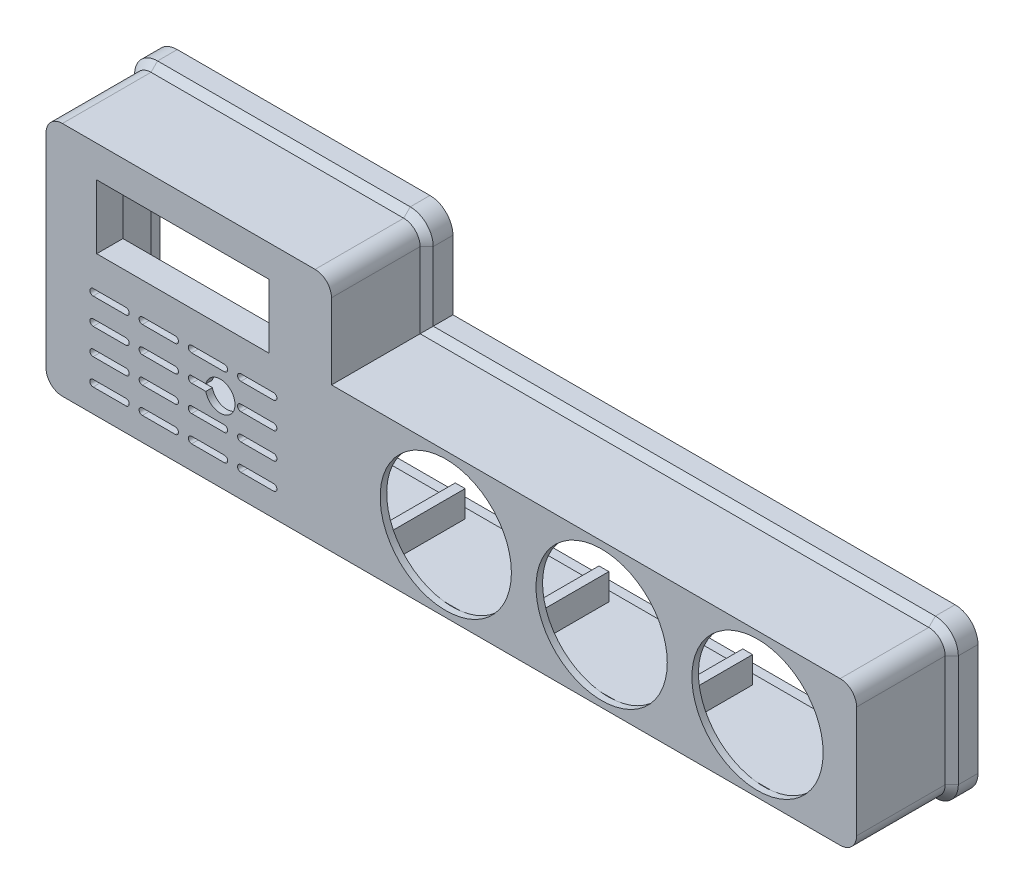
from build123d import *

# Parameters (mm, degrees)
EXTRUDE_1_DEPTH      = 30
EXTRUDE_START        = -2
EXTRUDE_2_DEPTH      = 2
SKETCH_3_R           = 20
CUT_EXTRUDE_1_DEPTH  = 2
EXTRUDE_3_DEPTH      = 5
EXTRUDE_3_DEPTH_BACK = 1
CHAMFER_1_SIZE       = 2
SKETCH_5_W           = 52.5
SKETCH_5_H           = 19.5
CUT_EXTRUDE_2_DEPTH  = 5
SKETCH_7_W           = 64.5
SKETCH_7_H           = 25.5
SKETCH_7_W_2         = 52.5
SKETCH_7_H_2         = 19.5
EXTRUDE_4_DEPTH      = 6
SKETCH_8_R           = 1.5
CUT_EXTRUDE_3_DEPTH  = 7
CUT_EXTRUDE_4_REACH  = 259.47
CUT_EXTRUDE_5_REACH  = 258.838
SKETCH_12_W          = 3
SKETCH_12_H          = 8
EXTRUDE_5_DEPTH      = 25
CUT_EXTRUDE_6_REACH  = 259.47
SKETCH_13_R          = 4.5


with BuildPart() as part:
    # 草图1 → 凸台-拉伸1 (new body)
    with BuildSketch(Plane.XY):
        with BuildLine():
            Line((78, 3), (1, 3))
            ThreePointArc((1, 3), (-2.535533906, 1.535533906), (-4, -2))
            Line((-4, -2), (-4, -64))
            ThreePointArc((-4, -64), (-2.535533906, -67.535533906), (1, -69))
            Line((1, -69), (238, -69))
            ThreePointArc((238, -69), (241.535533906, -67.535533906), (243, -64))
            Line((243, -64), (243, -30))
            ThreePointArc((243, -30), (241.535533906, -26.464466094), (238, -25))
            Line((238, -25), (83, -25))
            Line((83, -25), (83, -2))
            ThreePointArc((83, -2), (81.535533906, 1.535533906), (78, 3))
        make_face()
        with BuildLine():
            Line((238, -27), (81, -27))
            Line((81, -27), (81, -2))
            ThreePointArc((81, -2), (80.121320344, 0.121320344), (78, 1))
            Line((78, 1), (1, 1))
            ThreePointArc((1, 1), (-1.121320344, 0.121320344), (-2, -2))
            Line((-2, -2), (-2, -64))
            ThreePointArc((-2, -64), (-1.121320344, -66.121320344), (1, -67))
            Line((1, -67), (238, -67))
            ThreePointArc((238, -67), (240.121320344, -66.121320344), (241, -64))
            Line((241, -64), (241, -30))
            ThreePointArc((241, -30), (240.121320344, -27.878679656), (238, -27))
        make_face(mode=Mode.SUBTRACT)
    extrude(amount=EXTRUDE_1_DEPTH)

    # 草图2 → 凸台-拉伸2 (add)
    with BuildSketch(Plane.XY.offset(30).offset(EXTRUDE_START)):
        with BuildLine():
            Line((78, 3), (1, 3))
            ThreePointArc((1, 3), (-2.535533906, 1.535533906), (-4, -2))
            Line((-4, -2), (-4, -64))
            ThreePointArc((-4, -64), (-2.535533906, -67.535533906), (1, -69))
            Line((1, -69), (238, -69))
            ThreePointArc((238, -69), (241.535533906, -67.535533906), (243, -64))
            Line((243, -64), (243, -30))
            ThreePointArc((243, -30), (241.535533906, -26.464466094), (238, -25))
            Line((238, -25), (83, -25))
            Line((83, -25), (83, -2))
            ThreePointArc((83, -2), (81.535533906, 1.535533906), (78, 3))
        make_face()
    extrude(amount=EXTRUDE_2_DEPTH)

    # 草图3 → 切除-拉伸1 (cut)
    with BuildSketch(Plane.XY.offset(30)):
        with Locations((117.815248816, -47.15)):
            Circle(SKETCH_3_R)
        with Locations((165.315248816, -47.15)):
            Circle(SKETCH_3_R)
        with Locations((212.815248816, -47.15)):
            Circle(SKETCH_3_R)
    extrude(amount=-CUT_EXTRUDE_1_DEPTH, mode=Mode.SUBTRACT)


with BuildPart() as body_2:
    # 草图4 → 凸台-拉伸3 (new, two sides: drawn at the far end of the back side and taken through both)
    with BuildSketch(Plane(origin=(0, 0, 0), x_dir=(-1, 0, 0), z_dir=(0, 0, -1)).offset(-EXTRUDE_3_DEPTH_BACK)):
        with BuildLine():
            Line((-238, -71), (-1, -71))
            ThreePointArc((-1, -71), (3.949747468, -68.949747468), (6, -64))
            Line((6, -64), (6, -2))
            ThreePointArc((6, -2), (3.949747468, 2.949747468), (-1, 5))
            Line((-1, 5), (-78, 5))
            ThreePointArc((-78, 5), (-82.949747468, 2.949747468), (-85, -2))
            Line((-85, -2), (-85, -23))
            Line((-85, -23), (-238, -23))
            ThreePointArc((-238, -23), (-242.949747468, -25.050252532), (-245, -30))
            Line((-245, -30), (-245, -64))
            ThreePointArc((-245, -64), (-242.949747468, -68.949747468), (-238, -71))
        make_face()
        with BuildLine():
            Line((-83, -2), (-83, -25))
            Line((-83, -25), (-238, -25))
            ThreePointArc((-238, -25), (-241.535533906, -26.464466094), (-243, -30))
            Line((-243, -30), (-243, -64))
            ThreePointArc((-243, -64), (-241.535533906, -67.535533906), (-238, -69))
            Line((-238, -69), (-1, -69))
            ThreePointArc((-1, -69), (2.535533906, -67.535533906), (4, -64))
            Line((4, -64), (4, -2))
            ThreePointArc((4, -2), (2.535533906, 1.535533906), (-1, 3))
            Line((-1, 3), (-78, 3))
            ThreePointArc((-78, 3), (-81.535533906, 1.535533906), (-83, -2))
        make_face(mode=Mode.SUBTRACT)
    extrude(amount=EXTRUDE_3_DEPTH + EXTRUDE_3_DEPTH_BACK)


with BuildPart() as part_1:
    add(part.part)

    # Combine 2: union body 2
    add(body_2.part)

    # 倒角1
    chamfer_1_edges = [part_1.edges().sort_by_distance(p)[0] for p in [
        (39.5, 3, 1),
        (81.535533906, 1.535533906, 1),
        (83, -13.5, 1),
        (160.5, -25, 1),
        (241.535533906, -26.464466094, 1),
        (243, -47, 1),
        (241.535533906, -67.535533906, 1),
        (119.5, -69, 1),
        (-2.535533906, -67.535533906, 1),
        (-4, -33, 1),
        (-2.535533906, 1.535533906, 1),
    ]]
    chamfer(chamfer_1_edges, length=CHAMFER_1_SIZE - 0.0001)  # a hair under: the kernel refuses the full size

    # 草图5 → 切除-拉伸2 (cut)
    with BuildSketch(Plane.XY.offset(30)):
        with Locations((37.697321385, -16.407805751)):
            Rectangle(SKETCH_5_W, SKETCH_5_H)
    extrude(amount=-CUT_EXTRUDE_2_DEPTH, mode=Mode.SUBTRACT)

    # 草图7 → 凸台-拉伸4 (add)
    with BuildSketch(Plane(origin=(0, 0, 28), x_dir=(-1, 0, 0), z_dir=(0, 0, -1))):
        with Locations((-37.697321385, -16.407805751)):
            Rectangle(SKETCH_7_W, SKETCH_7_H)
        with Locations((-37.697321385, -16.407805751)):
            Rectangle(SKETCH_7_W_2, SKETCH_7_H_2, mode=Mode.SUBTRACT)
    extrude(amount=EXTRUDE_4_DEPTH)

    # 草图8 → 切除-拉伸3 (cut)
    with BuildSketch(Plane(origin=(0, 0, 22), x_dir=(-1, 0, 0), z_dir=(0, 0, -1))):
        with Locations((-8.697321385, -6.207805751)):
            Circle(SKETCH_8_R)
        with Locations((-8.697321385, -26.607805751)):
            Circle(SKETCH_8_R)
        with Locations((-66.697321385, -26.607805751)):
            Circle(SKETCH_8_R)
        with Locations((-66.697321385, -6.207805751)):
            Circle(SKETCH_8_R)
    extrude(amount=-CUT_EXTRUDE_3_DEPTH, mode=Mode.SUBTRACT)

    # 草图9 → 切除-拉伸4 (cut, up to next)
    with BuildSketch(Plane.XY.offset(30), mode=Mode.PRIVATE) as cut_extrude_4_sk1:
        with BuildLine():
            Line((10.367590172, -35.855469826), (20.367590172, -35.855469826))
            ThreePointArc((20.367590172, -35.855469826), (21.367590172, -36.855469826), (20.367590172, -37.855469826))
            Line((20.367590172, -37.855469826), (10.367590172, -37.855469826))
            ThreePointArc((10.367590172, -37.855469826), (9.367590172, -36.855469826), (10.367590172, -35.855469826))
        make_face()
    cut_extrude_4_tool1 = extrude(cut_extrude_4_sk1.sketch, amount=-CUT_EXTRUDE_4_REACH, mode=Mode.PRIVATE) & part_1.part
    # 草图9 → 切除-拉伸4 (cut, up to next)
    with BuildSketch(Plane.XY.offset(30), mode=Mode.PRIVATE) as cut_extrude_4_sk2:
        with BuildLine():
            Line((25.367590172, -35.855469826), (35.367590172, -35.855469826))
            ThreePointArc((35.367590172, -35.855469826), (36.367590172, -36.855469826), (35.367590172, -37.855469826))
            Line((35.367590172, -37.855469826), (25.367590172, -37.855469826))
            ThreePointArc((25.367590172, -37.855469826), (24.367590172, -36.855469826), (25.367590172, -35.855469826))
        make_face()
    cut_extrude_4_tool2 = extrude(cut_extrude_4_sk2.sketch, amount=-CUT_EXTRUDE_4_REACH, mode=Mode.PRIVATE) & part_1.part
    # 草图9 → 切除-拉伸4 (cut, up to next)
    with BuildSketch(Plane.XY.offset(30), mode=Mode.PRIVATE) as cut_extrude_4_sk3:
        with BuildLine():
            Line((40.367590172, -35.855469826), (50.367590172, -35.855469826))
            ThreePointArc((50.367590172, -35.855469826), (51.367590172, -36.855469826), (50.367590172, -37.855469826))
            Line((50.367590172, -37.855469826), (40.367590172, -37.855469826))
            ThreePointArc((40.367590172, -37.855469826), (39.367590172, -36.855469826), (40.367590172, -35.855469826))
        make_face()
    cut_extrude_4_tool3 = extrude(cut_extrude_4_sk3.sketch, amount=-CUT_EXTRUDE_4_REACH, mode=Mode.PRIVATE) & part_1.part
    # 草图9 → 切除-拉伸4 (cut, up to next)
    with BuildSketch(Plane.XY.offset(30), mode=Mode.PRIVATE) as cut_extrude_4_sk4:
        with BuildLine():
            Line((55.367590172, -35.855469826), (65.367590172, -35.855469826))
            ThreePointArc((65.367590172, -35.855469826), (66.367590172, -36.855469826), (65.367590172, -37.855469826))
            Line((65.367590172, -37.855469826), (55.367590172, -37.855469826))
            ThreePointArc((55.367590172, -37.855469826), (54.367590172, -36.855469826), (55.367590172, -35.855469826))
        make_face()
    cut_extrude_4_tool4 = extrude(cut_extrude_4_sk4.sketch, amount=-CUT_EXTRUDE_4_REACH, mode=Mode.PRIVATE) & part_1.part
    # 草图9 → 切除-拉伸4 (cut, up to next)
    with BuildSketch(Plane.XY.offset(30), mode=Mode.PRIVATE) as cut_extrude_4_sk5:
        with BuildLine():
            Line((25.367590172, -43.855469826), (35.367590172, -43.855469826))
            ThreePointArc((35.367590172, -43.855469826), (36.367590172, -44.855469826), (35.367590172, -45.855469826))
            Line((35.367590172, -45.855469826), (25.367590172, -45.855469826))
            ThreePointArc((25.367590172, -45.855469826), (24.367590172, -44.855469826), (25.367590172, -43.855469826))
        make_face()
    cut_extrude_4_tool5 = extrude(cut_extrude_4_sk5.sketch, amount=-CUT_EXTRUDE_4_REACH, mode=Mode.PRIVATE) & part_1.part
    # 草图9 → 切除-拉伸4 (cut, up to next)
    with BuildSketch(Plane.XY.offset(30), mode=Mode.PRIVATE) as cut_extrude_4_sk6:
        with BuildLine():
            Line((40.367590172, -43.855469826), (50.367590172, -43.855469826))
            ThreePointArc((50.367590172, -43.855469826), (51.367590172, -44.855469826), (50.367590172, -45.855469826))
            Line((50.367590172, -45.855469826), (40.367590172, -45.855469826))
            ThreePointArc((40.367590172, -45.855469826), (39.367590172, -44.855469826), (40.367590172, -43.855469826))
        make_face()
    cut_extrude_4_tool6 = extrude(cut_extrude_4_sk6.sketch, amount=-CUT_EXTRUDE_4_REACH, mode=Mode.PRIVATE) & part_1.part
    # 草图9 → 切除-拉伸4 (cut, up to next)
    with BuildSketch(Plane.XY.offset(30), mode=Mode.PRIVATE) as cut_extrude_4_sk7:
        with BuildLine():
            Line((55.367590172, -43.855469826), (65.367590172, -43.855469826))
            ThreePointArc((65.367590172, -43.855469826), (66.367590172, -44.855469826), (65.367590172, -45.855469826))
            Line((65.367590172, -45.855469826), (55.367590172, -45.855469826))
            ThreePointArc((55.367590172, -45.855469826), (54.367590172, -44.855469826), (55.367590172, -43.855469826))
        make_face()
    cut_extrude_4_tool7 = extrude(cut_extrude_4_sk7.sketch, amount=-CUT_EXTRUDE_4_REACH, mode=Mode.PRIVATE) & part_1.part
    # 草图9 → 切除-拉伸4 (cut, up to next)
    with BuildSketch(Plane.XY.offset(30), mode=Mode.PRIVATE) as cut_extrude_4_sk8:
        with BuildLine():
            Line((25.367590172, -51.855469826), (35.367590172, -51.855469826))
            ThreePointArc((35.367590172, -51.855469826), (36.367590172, -52.855469826), (35.367590172, -53.855469826))
            Line((35.367590172, -53.855469826), (25.367590172, -53.855469826))
            ThreePointArc((25.367590172, -53.855469826), (24.367590172, -52.855469826), (25.367590172, -51.855469826))
        make_face()
    cut_extrude_4_tool8 = extrude(cut_extrude_4_sk8.sketch, amount=-CUT_EXTRUDE_4_REACH, mode=Mode.PRIVATE) & part_1.part
    # 草图9 → 切除-拉伸4 (cut, up to next)
    with BuildSketch(Plane.XY.offset(30), mode=Mode.PRIVATE) as cut_extrude_4_sk9:
        with BuildLine():
            Line((40.367590172, -51.855469826), (50.367590172, -51.855469826))
            ThreePointArc((50.367590172, -51.855469826), (51.367590172, -52.855469826), (50.367590172, -53.855469826))
            Line((50.367590172, -53.855469826), (40.367590172, -53.855469826))
            ThreePointArc((40.367590172, -53.855469826), (39.367590172, -52.855469826), (40.367590172, -51.855469826))
        make_face()
    cut_extrude_4_tool9 = extrude(cut_extrude_4_sk9.sketch, amount=-CUT_EXTRUDE_4_REACH, mode=Mode.PRIVATE) & part_1.part
    # 草图9 → 切除-拉伸4 (cut, up to next)
    with BuildSketch(Plane.XY.offset(30), mode=Mode.PRIVATE) as cut_extrude_4_sk10:
        with BuildLine():
            Line((55.367590172, -51.855469826), (65.367590172, -51.855469826))
            ThreePointArc((65.367590172, -51.855469826), (66.367590172, -52.855469826), (65.367590172, -53.855469826))
            Line((65.367590172, -53.855469826), (55.367590172, -53.855469826))
            ThreePointArc((55.367590172, -53.855469826), (54.367590172, -52.855469826), (55.367590172, -51.855469826))
        make_face()
    cut_extrude_4_tool10 = extrude(cut_extrude_4_sk10.sketch, amount=-CUT_EXTRUDE_4_REACH, mode=Mode.PRIVATE) & part_1.part
    # 草图9 → 切除-拉伸4 (cut, up to next)
    with BuildSketch(Plane.XY.offset(30), mode=Mode.PRIVATE) as cut_extrude_4_sk11:
        with BuildLine():
            Line((25.367590172, -59.855469826), (35.367590172, -59.855469826))
            ThreePointArc((35.367590172, -59.855469826), (36.367590172, -60.855469826), (35.367590172, -61.855469826))
            Line((35.367590172, -61.855469826), (25.367590172, -61.855469826))
            ThreePointArc((25.367590172, -61.855469826), (24.367590172, -60.855469826), (25.367590172, -59.855469826))
        make_face()
    cut_extrude_4_tool11 = extrude(cut_extrude_4_sk11.sketch, amount=-CUT_EXTRUDE_4_REACH, mode=Mode.PRIVATE) & part_1.part
    # 草图9 → 切除-拉伸4 (cut, up to next)
    with BuildSketch(Plane.XY.offset(30), mode=Mode.PRIVATE) as cut_extrude_4_sk12:
        with BuildLine():
            Line((40.367590172, -59.855469826), (50.367590172, -59.855469826))
            ThreePointArc((50.367590172, -59.855469826), (51.367590172, -60.855469826), (50.367590172, -61.855469826))
            Line((50.367590172, -61.855469826), (40.367590172, -61.855469826))
            ThreePointArc((40.367590172, -61.855469826), (39.367590172, -60.855469826), (40.367590172, -59.855469826))
        make_face()
    cut_extrude_4_tool12 = extrude(cut_extrude_4_sk12.sketch, amount=-CUT_EXTRUDE_4_REACH, mode=Mode.PRIVATE) & part_1.part
    # 草图9 → 切除-拉伸4 (cut, up to next)
    with BuildSketch(Plane.XY.offset(30), mode=Mode.PRIVATE) as cut_extrude_4_sk13:
        with BuildLine():
            Line((55.367590172, -59.855469826), (65.367590172, -59.855469826))
            ThreePointArc((65.367590172, -59.855469826), (66.367590172, -60.855469826), (65.367590172, -61.855469826))
            Line((65.367590172, -61.855469826), (55.367590172, -61.855469826))
            ThreePointArc((55.367590172, -61.855469826), (54.367590172, -60.855469826), (55.367590172, -59.855469826))
        make_face()
    cut_extrude_4_tool13 = extrude(cut_extrude_4_sk13.sketch, amount=-CUT_EXTRUDE_4_REACH, mode=Mode.PRIVATE) & part_1.part
    # 草图9 → 切除-拉伸4 (cut, up to next)
    with BuildSketch(Plane.XY.offset(30), mode=Mode.PRIVATE) as cut_extrude_4_sk14:
        with BuildLine():
            Line((10.367590172, -43.855469826), (20.367590172, -43.855469826))
            ThreePointArc((20.367590172, -43.855469826), (21.367590172, -44.855469826), (20.367590172, -45.855469826))
            Line((20.367590172, -45.855469826), (10.367590172, -45.855469826))
            ThreePointArc((10.367590172, -45.855469826), (9.367590172, -44.855469826), (10.367590172, -43.855469826))
        make_face()
    cut_extrude_4_tool14 = extrude(cut_extrude_4_sk14.sketch, amount=-CUT_EXTRUDE_4_REACH, mode=Mode.PRIVATE) & part_1.part
    # 草图9 → 切除-拉伸4 (cut, up to next)
    with BuildSketch(Plane.XY.offset(30), mode=Mode.PRIVATE) as cut_extrude_4_sk15:
        with BuildLine():
            Line((10.367590172, -51.855469826), (20.367590172, -51.855469826))
            ThreePointArc((20.367590172, -51.855469826), (21.367590172, -52.855469826), (20.367590172, -53.855469826))
            Line((20.367590172, -53.855469826), (10.367590172, -53.855469826))
            ThreePointArc((10.367590172, -53.855469826), (9.367590172, -52.855469826), (10.367590172, -51.855469826))
        make_face()
    cut_extrude_4_tool15 = extrude(cut_extrude_4_sk15.sketch, amount=-CUT_EXTRUDE_4_REACH, mode=Mode.PRIVATE) & part_1.part
    # 草图9 → 切除-拉伸4 (cut, up to next)
    with BuildSketch(Plane.XY.offset(30), mode=Mode.PRIVATE) as cut_extrude_4_sk16:
        with BuildLine():
            Line((10.367590172, -59.855469826), (20.367590172, -59.855469826))
            ThreePointArc((20.367590172, -59.855469826), (21.367590172, -60.855469826), (20.367590172, -61.855469826))
            Line((20.367590172, -61.855469826), (10.367590172, -61.855469826))
            ThreePointArc((10.367590172, -61.855469826), (9.367590172, -60.855469826), (10.367590172, -59.855469826))
        make_face()
    cut_extrude_4_tool16 = extrude(cut_extrude_4_sk16.sketch, amount=-CUT_EXTRUDE_4_REACH, mode=Mode.PRIVATE) & part_1.part
    add(cut_extrude_4_tool1.solids().sort_by_distance((15.36759, -36.85547, 30))[0], mode=Mode.SUBTRACT)
    add(cut_extrude_4_tool2.solids().sort_by_distance((30.36759, -36.85547, 30))[0], mode=Mode.SUBTRACT)
    add(cut_extrude_4_tool3.solids().sort_by_distance((45.36759, -36.85547, 30))[0], mode=Mode.SUBTRACT)
    add(cut_extrude_4_tool4.solids().sort_by_distance((60.36759, -36.85547, 30))[0], mode=Mode.SUBTRACT)
    add(cut_extrude_4_tool5.solids().sort_by_distance((30.36759, -44.85547, 30))[0], mode=Mode.SUBTRACT)
    add(cut_extrude_4_tool6.solids().sort_by_distance((45.36759, -44.85547, 30))[0], mode=Mode.SUBTRACT)
    add(cut_extrude_4_tool7.solids().sort_by_distance((60.36759, -44.85547, 30))[0], mode=Mode.SUBTRACT)
    add(cut_extrude_4_tool8.solids().sort_by_distance((30.36759, -52.85547, 30))[0], mode=Mode.SUBTRACT)
    add(cut_extrude_4_tool9.solids().sort_by_distance((45.36759, -52.85547, 30))[0], mode=Mode.SUBTRACT)
    add(cut_extrude_4_tool10.solids().sort_by_distance((60.36759, -52.85547, 30))[0], mode=Mode.SUBTRACT)
    add(cut_extrude_4_tool11.solids().sort_by_distance((30.36759, -60.85547, 30))[0], mode=Mode.SUBTRACT)
    add(cut_extrude_4_tool12.solids().sort_by_distance((45.36759, -60.85547, 30))[0], mode=Mode.SUBTRACT)
    add(cut_extrude_4_tool13.solids().sort_by_distance((60.36759, -60.85547, 30))[0], mode=Mode.SUBTRACT)
    add(cut_extrude_4_tool14.solids().sort_by_distance((15.36759, -44.85547, 30))[0], mode=Mode.SUBTRACT)
    add(cut_extrude_4_tool15.solids().sort_by_distance((15.36759, -52.85547, 30))[0], mode=Mode.SUBTRACT)
    add(cut_extrude_4_tool16.solids().sort_by_distance((15.36759, -60.85547, 30))[0], mode=Mode.SUBTRACT)

    # 草图11 → 切除-拉伸5 (cut, up to next)
    with BuildSketch(Plane(origin=(0, 0, 0), x_dir=(-1, 0, 0), z_dir=(0, 0, -1)), mode=Mode.PRIVATE) as cut_extrude_5_sk1:
        with BuildLine():
            Line((-83.2, -2), (-83.2, -24.8))
            Line((-83.2, -24.8), (-238, -24.8))
            ThreePointArc((-238, -24.8), (-241.676955262, -26.323044738), (-243.2, -30))
            Line((-243.2, -30), (-243.2, -64))
            ThreePointArc((-243.2, -64), (-241.676955262, -67.676955262), (-238, -69.2))
            Line((-238, -69.2), (-1, -69.2))
            ThreePointArc((-1, -69.2), (2.676955262, -67.676955262), (4.2, -64))
            Line((4.2, -64), (4.2, -2))
            ThreePointArc((4.2, -2), (2.676955262, 1.676955262), (-1, 3.2))
            Line((-1, 3.2), (-78, 3.2))
            ThreePointArc((-78, 3.2), (-81.676955262, 1.676955262), (-83.2, -2))
        make_face()
    cut_extrude_5_tool1 = extrude(cut_extrude_5_sk1.sketch, amount=CUT_EXTRUDE_5_REACH, mode=Mode.PRIVATE) & part_1.part
    add(cut_extrude_5_tool1.solids().sort_by_distance((104.909063, -40.423616, 0))[0], mode=Mode.SUBTRACT)

    # 草图12 → 凸台-拉伸5 (add)
    with BuildSketch(Plane(origin=(0, 0, 28), x_dir=(-1, 0, 0), z_dir=(0, 0, -1))):
        with Locations((-182.817864909, -31)):
            Rectangle(SKETCH_12_W, SKETCH_12_H)
        with Locations((-182.817864909, -63)):
            Rectangle(SKETCH_12_W, SKETCH_12_H)
        with Locations((-139.017864909, -31)):
            Rectangle(SKETCH_12_W, SKETCH_12_H)
        with Locations((-139.017864909, -63)):
            Rectangle(SKETCH_12_W, SKETCH_12_H)
        with Locations((-95.217864909, -31)):
            Rectangle(SKETCH_12_W, SKETCH_12_H)
        with Locations((-95.217864909, -63)):
            Rectangle(SKETCH_12_W, SKETCH_12_H)
    extrude(amount=EXTRUDE_5_DEPTH)

    # 草图13 → 切除-拉伸6 (cut, up to next)
    with BuildSketch(Plane.XY.offset(30), mode=Mode.PRIVATE) as cut_extrude_6_sk1:
        with Locations((49.099998543, -44.899998759)):
            Circle(SKETCH_13_R)
    cut_extrude_6_tool1 = extrude(cut_extrude_6_sk1.sketch, amount=-CUT_EXTRUDE_6_REACH, mode=Mode.PRIVATE) & part_1.part
    add(cut_extrude_6_tool1.solids().sort_by_distance((49.099999, -44.899999, 30))[0], mode=Mode.SUBTRACT)


solid = part_1.part
